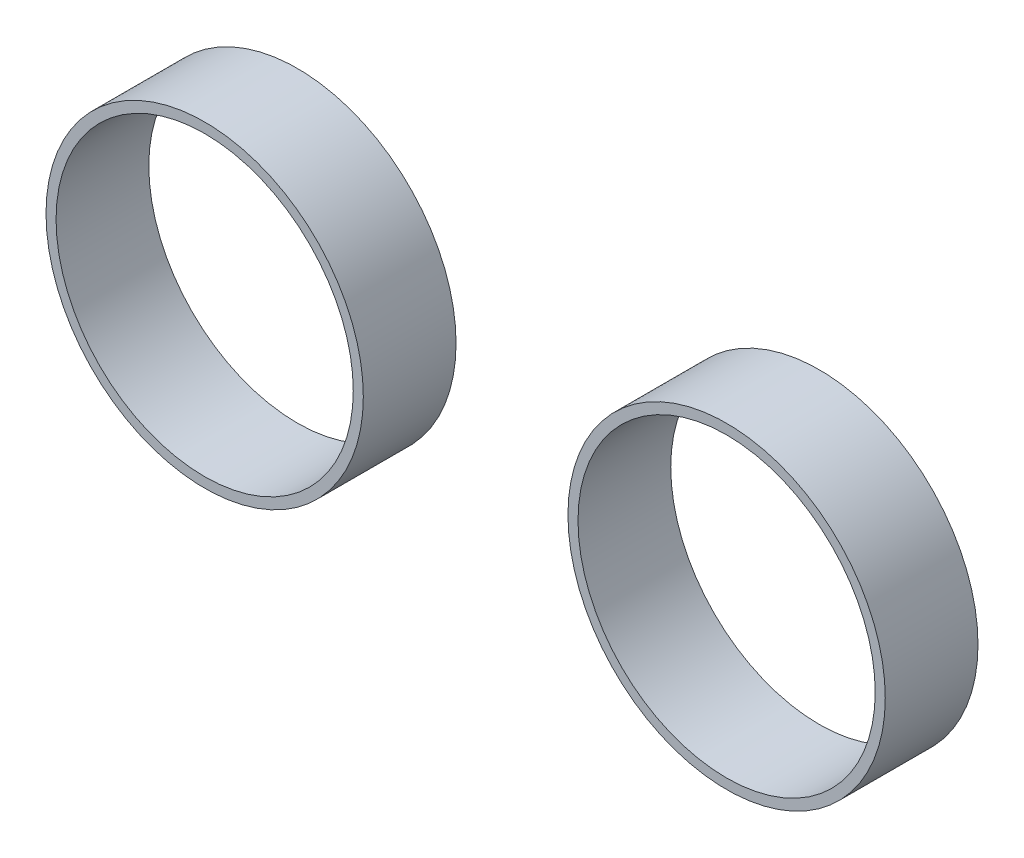
from build123d import *

# Parameters (mm, degrees)
SKETCH1_R             = 69.4
SKETCH1_R_2           = 65
BOSS_EXTRUDE1_DEPTH   = 40.56
BOSS_EXTRUDE1_2_DEPTH = 40.56


with BuildPart() as part:
    # Sketch1 → Boss-Extrude1 (new body)
    with BuildSketch(Plane.XY):
        with Locations((1435.980472759, -423.382336202)):
            Circle(SKETCH1_R)
        with Locations((1435.980472759, -423.382336202)):
            Circle(SKETCH1_R_2, mode=Mode.SUBTRACT)
    extrude(amount=BOSS_EXTRUDE1_DEPTH)


with BuildPart() as body_2:
    # Sketch1 → Boss-Extrude1 2 (new body)
    with BuildSketch(Plane.XY):
        with Locations((1664.280472759, -423.382336202)):
            Circle(SKETCH1_R)
        with Locations((1664.280472759, -423.382336202)):
            Circle(SKETCH1_R_2, mode=Mode.SUBTRACT)
    extrude(amount=BOSS_EXTRUDE1_2_DEPTH)


solid = Compound([part.part, body_2.part])
